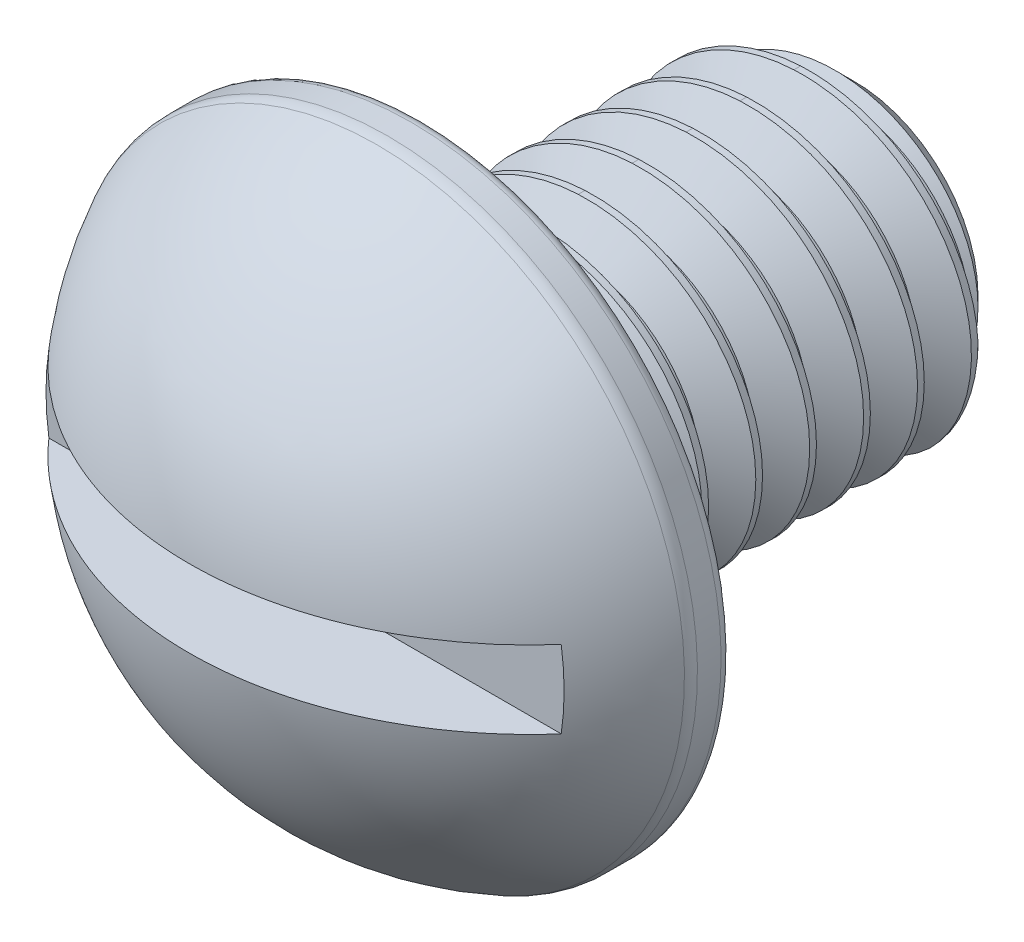
from build123d import *

# Parameters (mm, degrees)
SKETCH1_R        = 4.5593
EXTRUDE3_DEPTH   = 3.4798
SKETCH4_W        = 6.35
SKETCH4_H        = 2.413
CHAMFER1_SIZE    = 0.5953125
CUT_SWEEP1_PITCH = 0.79375
CUT_SWEEP1_TO    = 6.35
SKETCH30_W       = 9.1186
SKETCH30_H       = 1.139825
EXTRUDE12_DEPTH  = 1.7399


with BuildPart() as part:
    # Sketch1 → Extrude3 (new body)
    with BuildSketch(Plane.XY):
        Circle(SKETCH1_R)
    extrude(amount=EXTRUDE3_DEPTH)

    # Sketch11 → Cut-Revolve3 (revolve, cut)
    with BuildSketch(Plane(origin=(0, 0, 0), x_dir=(0, 0, -1), z_dir=(1, 0, 0))):
        with BuildLine():
            Line((-3.7338, 5.29717), (0, 5.29717))
            Line((0, 5.29717), (0, 4.38531))
            ThreePointArc((0, 4.38531), (-0.050960491, 4.508339509), (-0.17399, 4.5593))
            Line((-0.17399, 4.5593), (-0.52197, 4.5593))
            ThreePointArc((-0.52197, 4.5593), (-0.601505866, 4.550088544), (-0.676830908, 4.522941853))
            ThreePointArc((-0.676830908, 4.522941853), (-2.722244181, 2.660528084), (-3.4798, 0))
            Line((-3.4798, 0), (-3.7338, 0))
            Line((-3.7338, 0), (-3.7338, 5.29717))
        make_face()
    revolve(axis=Axis((0, 0, 0), (0, 0, 1)), mode=Mode.SUBTRACT)

    # Sketch30 → Extrude12 (cut)
    with BuildSketch(Plane.XY.offset(3.4798)):
        Rectangle(SKETCH30_W, SKETCH30_H)
    extrude(amount=-EXTRUDE12_DEPTH, mode=Mode.SUBTRACT)


with BuildPart() as body_2:
    # Sketch4 → Revolve1 (revolve)
    with BuildSketch(Plane(origin=(0, 0, 0), x_dir=(0, 0, -1), z_dir=(1, 0, 0)), mode=Mode.PRIVATE) as revolve1_sk:
        with Locations((3.175, 1.2065)):
            Rectangle(SKETCH4_W, SKETCH4_H)
    revolve(revolve1_sk.sketch.rotate(Axis((0, 0, 0), (0, 0, -1)), 90), axis=Axis((0, 0, 0), (0, 0, -1)))

    # Chamfer1
    chamfer1_edges = [body_2.edges().sort_by_distance(p)[0] for p in [
        (-2.413, 0, -6.35),
    ]]
    chamfer(chamfer1_edges, length=CHAMFER1_SIZE)

    # Cut-Sweep1: arcs per turn and ends read off the stored shape
    # Cut-Sweep1: the profile of Sketch14 profile screwed along a right-hand helix through 9 turns, 8 arcs to a turn; built about Z, then put on its axis
    cut_sweep1_z = Axis((0, 0, 0), (0, 0, 1))
    cut_sweep1_corners = [(2.4133, 0, -0.198264295), (2.4133, 0, -0.893141955), (1.897444252, 0, -0.5953125), (1.897444252, 0, -0.49609375)]
    with BuildLine(mode=Mode.PRIVATE) as cut_sweep1_profile:
        Line(cut_sweep1_corners[0], cut_sweep1_corners[1])
        Line(cut_sweep1_corners[1], cut_sweep1_corners[2])
        Line(cut_sweep1_corners[2], cut_sweep1_corners[3])
        Line(cut_sweep1_corners[3], cut_sweep1_corners[0])
    cut_sweep1_cap = Face(cut_sweep1_profile.wire())
    cut_sweep1_turn_angles = [0, 22.5, 45, 67.5, 90, 112.5, 135, 157.5, 180, 202.5, 225, 247.5, 270, 292.5, 315, 337.5, 360]
    cut_sweep1_turn_weights = [1, 0.9238795325112867, 1, 0.9238795325112867, 1, 0.9238795325112867, 1, 0.9238795325112867, 1, 0.9238795325112867, 1, 0.9238795325112867, 1, 0.9238795325112867, 1, 0.9238795325112867, 1]
    cut_sweep1_turn_rails = [Edge.make_bspline([Vector(p[0], p[1], 0).rotate(cut_sweep1_z, cut_sweep1_turn_angles[k]) / cut_sweep1_turn_weights[k] + Vector(0, 0, p[2] + CUT_SWEEP1_PITCH * cut_sweep1_turn_angles[k] / 360) for k in range(17)], [0, 0, 0, 1, 1, 2, 2, 3, 3, 4, 4, 5, 5, 6, 6, 7, 7, 8, 8, 8], 2, cut_sweep1_turn_weights) for p in cut_sweep1_corners]
    cut_sweep1_turn_sides = [Face.make_surface_from_curves(cut_sweep1_turn_rails[p[0]], cut_sweep1_turn_rails[p[1]]) for p in [(0, 1), (1, 2), (2, 3), (3, 0)]]
    cut_sweep1 = Plane(origin=(0, 0, -6.35), x_dir=(1, 0, 0), z_dir=(0, 0, 1)) * split(Solid(Shell([*[p.moved(Location((0, 0, CUT_SWEEP1_PITCH * i))) for i in range(9) for p in cut_sweep1_turn_sides], cut_sweep1_cap, cut_sweep1_cap.rotate(cut_sweep1_z, 3240).moved(Location((0, 0, CUT_SWEEP1_PITCH * 3240 / 360)))])), bisect_by=Plane.XY.offset(CUT_SWEEP1_TO), keep=Keep.BOTTOM, mode=Mode.PRIVATE)
    add(cut_sweep1, mode=Mode.SUBTRACT)


solid = Compound([part.part, body_2.part])
